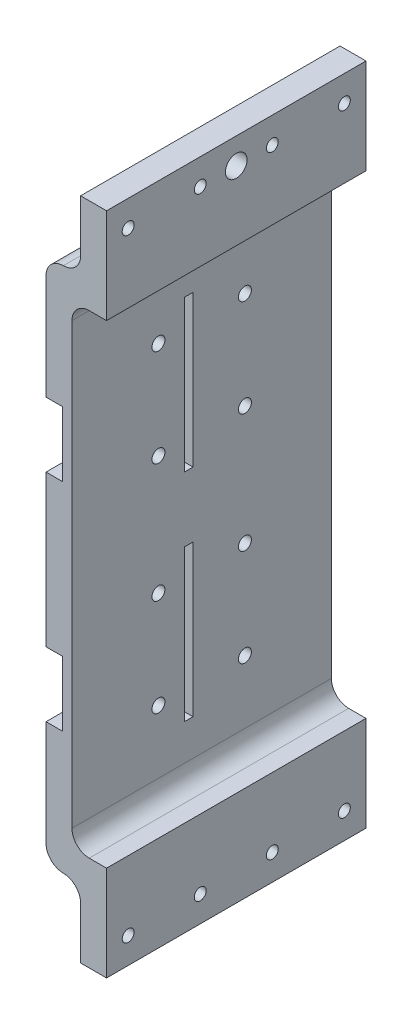
from build123d import *

# Parameters (mm, degrees)
BOSS_EXTRUDE1_DEPTH               = 38.1
FILLET1_R                         = 5.08
SKETCH8_R                         = 1.7499965
SKETCH8_R_2                       = 1.75
CUT_EXTRUDE2_DEPTH                = 7.62
F_1_8_0_15_DOWEL_HOLE1_AT_2_COUNT = 2
F_1_8_0_15_DOWEL_HOLE1_AT_2_PITCH = 28.575
F_1_8_0_15_DOWEL_HOLE1_AT_3_COUNT = 2
F_1_8_0_15_DOWEL_HOLE1_AT_3_PITCH = 34.925
F_1_8_0_15_DOWEL_HOLE1_AT_4_COUNT = 2
F_1_8_0_15_DOWEL_HOLE1_AT_4_PITCH = 63.5
CUT_EXTRUDE3_DEPTH                = 4.7752
LPATTERN1_COUNT                   = 2
LPATTERN1_PITCH                   = 63.5
LPATTERN1_COUNT_DIR2              = 2
LPATTERN1_PITCH_DIR2              = 25.4
SKETCH16_W                        = 2.54
SKETCH16_H                        = 44.45
CUT_EXTRUDE4_DEPTH                = 7.62
SKETCH17_W                        = 76.2
SKETCH17_H                        = 19.05
CUT_EXTRUDE5_DEPTH                = 4.7752
SKETCH19_W                        = 12.6492
SKETCH19_H                        = 19.05
SKETCH19_W_2                      = 5.0292
BOSS_EXTRUDE6_DEPTH               = 4.7752
SKETCH22_R                        = 3.175
CGTEST1_DEPTH                     = 7.62


with BuildPart() as part:
    # Sketch1 → Boss-Extrude1 (new, symmetric)
    with BuildSketch(Plane.XY):
        Polygon((0, -24.348466848), (0, 114.923832009), (10.16, 114.923832009), (10.16, 122.543832009), (10.16, 142.863832009), (2.54, 142.863832009), (2.54, 122.543832009), (-7.62, 122.543832009), (-7.62, 114.923832009), (-7.62, -31.968466848), (2.54, -31.968466848), (2.54, -52.288466848), (10.16, -52.288466848), (10.16, -31.968466848), (10.16, -24.348466848), align=None)
    extrude(amount=BOSS_EXTRUDE1_DEPTH, both=True)

    # Fillet1
    fillet1_edges = [part.edges().sort_by_distance(p)[0] for p in [
        (0, -24.348466848, 0),
        (2.54, -31.968466848, 0),
        (0, 114.923832009, 0),
        (2.54, 122.543832009, 0),
        (-7.62, 122.543832009, 0),
        (-7.62, -31.968466848, 0),
    ]]
    fillet(fillet1_edges, radius=FILLET1_R - 0.0001)  # a hair under: the kernel refuses the full size

    # Sketch8 → Cut-Extrude2 (cut)
    with BuildSketch(Plane.ZY.offset(-2.54)):
        with Locations(Location((-31.75, 135.243832009, 0), (0, 0, 270))):
            Circle(SKETCH8_R)
        with Locations(Location((31.75, 135.243832009, 0), (0, 0, 270))):
            Circle(SKETCH8_R)
        with Locations(Location((-10.583333333, 135.243832009, 0), (0, 0, 270))):
            Circle(SKETCH8_R_2)
        with Locations(Location((10.583333333, 135.243832009, 0), (0, 0, 270))):
            Circle(SKETCH8_R_2)
    cut_extrude2 = extrude(amount=-CUT_EXTRUDE2_DEPTH, mode=Mode.SUBTRACT)

    # Mirror1: Cut-Extrude2 across plane
    add(cut_extrude2.mirror(Plane.ZX.offset(45.28768258)), mode=Mode.SUBTRACT)

    # Sketch11 → 1/8 (0.15) Dowel Hole1 (revolve, cut)
    with BuildSketch(Plane(origin=(-7.62, 27.82518258, 12.7), x_dir=(0, 0, 1), z_dir=(0, 1, 0))):
        Polygon((0, 0), (0, 8.764639479), (1.905, 7.62), (1.905, 0), align=None)
    f_1_8_0_15_dowel_hole1 = revolve(axis=Axis((-13.97, 27.82518258, 12.7), (1, 0, 0)), mode=Mode.SUBTRACT)

    # 1/8 (0.15) Dowel Hole1 at 2: 1/8 (0.15) Dowel Hole1 ×2
    with Locations(*[(0, -i * F_1_8_0_15_DOWEL_HOLE1_AT_2_PITCH, 0) for i in range(1, F_1_8_0_15_DOWEL_HOLE1_AT_2_COUNT)]):
        add(f_1_8_0_15_dowel_hole1, mode=Mode.SUBTRACT)

    # 1/8 (0.15) Dowel Hole1 at 3: 1/8 (0.15) Dowel Hole1 ×2
    with Locations(*[(0, i * F_1_8_0_15_DOWEL_HOLE1_AT_3_PITCH, 0) for i in range(1, F_1_8_0_15_DOWEL_HOLE1_AT_3_COUNT)]):
        add(f_1_8_0_15_dowel_hole1, mode=Mode.SUBTRACT)

    # 1/8 (0.15) Dowel Hole1 at 4: 1/8 (0.15) Dowel Hole1 ×2
    with Locations(*[(0, i * F_1_8_0_15_DOWEL_HOLE1_AT_4_PITCH, 0) for i in range(1, F_1_8_0_15_DOWEL_HOLE1_AT_4_COUNT)]):
        add(f_1_8_0_15_dowel_hole1, mode=Mode.SUBTRACT)

    # Sketch14 → Cut-Extrude3 (cut)
    with BuildSketch(Plane.ZY.offset(7.62)):
        Polygon((13.9954, 95.427086941), (11.4046, 95.427086941), (10.1092, 94.136177076), (10.1092, 59.947777076), (11.400109865, 58.652377076), (12.7, 58.652377076), (13.999890135, 58.652377076), (15.2908, 59.947777076), (15.2908, 94.136177076), align=None)
    cut_extrude3 = extrude(amount=-CUT_EXTRUDE3_DEPTH, mode=Mode.SUBTRACT)

    # LPattern1: Cut-Extrude3 2 × 2
    with Locations(*[(0, -i * LPATTERN1_PITCH, -j * LPATTERN1_PITCH_DIR2) for i in range(LPATTERN1_COUNT) for j in range(LPATTERN1_COUNT_DIR2) if (i, j) != (0, 0)]):
        add(cut_extrude3, mode=Mode.SUBTRACT)

    # Mirror2: 1/8 (0.15) Dowel Hole1 across plane
    add(f_1_8_0_15_dowel_hole1.mirror(Plane.XY), mode=Mode.SUBTRACT)

    # Mirror2 copy 1 sketch → Mirror2 copy 1 (revolve, cut)
    with BuildSketch(Plane(origin=(-7.62, -0.74981742, -12.7), x_dir=(0, 0, -1), z_dir=(0, 1, 0))):
        Polygon((0, 0), (0, -8.764639479), (1.905, -7.62), (1.905, 0), align=None)
    revolve(axis=Axis((-13.97, -0.74981742, -12.7), (-1, 0, 0)), mode=Mode.SUBTRACT)

    # Mirror2 copy 2 sketch → Mirror2 copy 2 (revolve, cut)
    with BuildSketch(Plane(origin=(-7.62, 62.75018258, -12.7), x_dir=(0, 0, -1), z_dir=(0, 1, 0))):
        Polygon((0, 0), (0, -8.764639479), (1.905, -7.62), (1.905, 0), align=None)
    revolve(axis=Axis((-13.97, 62.75018258, -12.7), (-1, 0, 0)), mode=Mode.SUBTRACT)

    # Mirror2 copy 3 sketch → Mirror2 copy 3 (revolve, cut)
    with BuildSketch(Plane(origin=(-7.62, 91.32518258, -12.7), x_dir=(0, 0, -1), z_dir=(0, 1, 0))):
        Polygon((0, 0), (0, -8.764639479), (1.905, -7.62), (1.905, 0), align=None)
    revolve(axis=Axis((-13.97, 91.32518258, -12.7), (-1, 0, 0)), mode=Mode.SUBTRACT)

    # Sketch16 → Cut-Extrude4 (cut)
    with BuildSketch(Plane.ZY.offset(7.62)):
        with Locations((3.81, 77.03768258)):
            Rectangle(SKETCH16_W, SKETCH16_H)
    cut_extrude4 = extrude(amount=-CUT_EXTRUDE4_DEPTH, mode=Mode.SUBTRACT)

    # Sketch17 → Cut-Extrude5 (cut)
    with BuildSketch(Plane.ZY.offset(7.62)):
        with Locations((0, 77.03768258)):
            Rectangle(SKETCH17_W, SKETCH17_H)
    cut_extrude5 = extrude(amount=-CUT_EXTRUDE5_DEPTH, mode=Mode.SUBTRACT)

    # Sketch19 → Boss-Extrude6 (add)
    with BuildSketch(Plane.ZY.offset(2.8448)):
        with Locations((-3.7846, 77.03768258)):
            Rectangle(SKETCH19_W, SKETCH19_H)
        with Locations((7.5946, 77.03768258)):
            Rectangle(SKETCH19_W_2, SKETCH19_H)
    boss_extrude6 = extrude(amount=BOSS_EXTRUDE6_DEPTH)

    # Mirror3: Cut-Extrude4, Cut-Extrude5, Boss-Extrude6 across plane
    add(cut_extrude4.mirror(Plane.ZX.offset(45.28768258)), mode=Mode.SUBTRACT)
    add(cut_extrude5.mirror(Plane.ZX.offset(45.28768258)), mode=Mode.SUBTRACT)
    add(boss_extrude6.mirror(Plane.ZX.offset(45.28768258)))

    # Sketch22 → CGTest1 (cut)
    with BuildSketch(Plane.ZY.offset(-2.54)):
        with Locations(Location((0, 135.243832009, 0), (0, 0, 270))):
            Circle(SKETCH22_R)
    extrude(amount=-CGTEST1_DEPTH, mode=Mode.SUBTRACT)


solid = part.part
